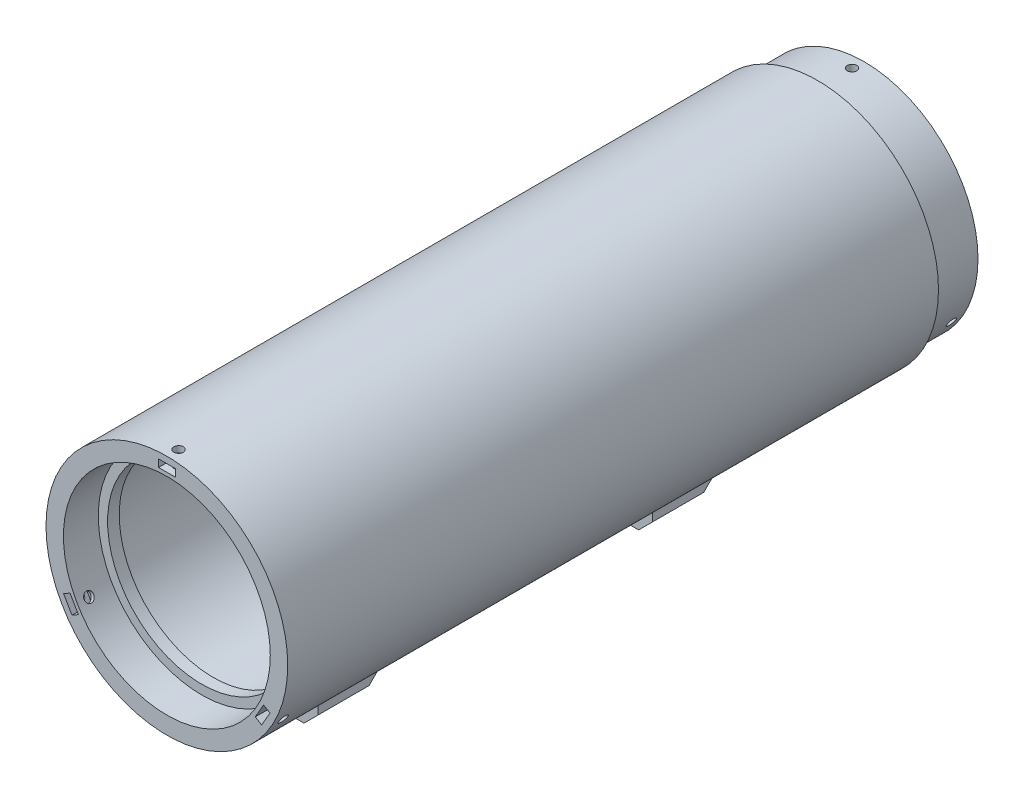
from build123d import *

# Parameters (mm, degrees)
SKETCH2_R                   = 31.115
SKETCH2_R_2                 = 23.495
BOSS_EXTRUDE1_DEPTH         = 12.7
BOSS_EXTRUDE2_START         = -6.35
SKETCH3_R                   = 23.495
SKETCH3_R_2                 = 19.685
BOSS_EXTRUDE2_DEPTH         = 6.35
M2_CLEARANCE_HOLE1_REACH    = 72.725
M2_CLEARANCE_HOLE1_BORE_R   = 1.3
CIRPATTERN1_COUNT           = 3
SKETCH7_W                   = 4.572
SKETCH7_H                   = 1.905
CUT_EXTRUDE1_DEPTH          = 5.461
CIRPATTERN2_COUNT           = 3
SKETCH8_R                   = 33.02
SKETCH8_R_2                 = 28.2575
BOSS_EXTRUDE3_DEPTH         = 177.8
M2_CLEARANCE_HOLE2_REACH    = 206.308
M2_CLEARANCE_HOLE2_BORE_R   = 1.3
SKETCH11_W                  = 4.572
SKETCH11_H                  = 2.032
CUT_EXTRUDE2_DEPTH          = 5.461
BOSS_EXTRUDE4_START         = -6.35
SKETCH12_R                  = 28.2575
SKETCH12_R_2                = 25.7175
BOSS_EXTRUDE4_DEPTH         = 6.35
CIRPATTERN3_COUNT           = 3
CUT_EXTRUDE5_START          = -3.175
SKETCH14_R                  = 28.2575
SKETCH14_R_2                = 25.7175
CUT_EXTRUDE5_DEPTH          = 3.175
SKETCH15_W                  = 19.05
SKETCH15_H                  = 22.86
BOSS_EXTRUDE5_DEPTH         = 12.7
F_1_4_CLEARANCE_HOLE1_D     = 7.14248
F_1_4_CLEARANCE_HOLE1_DEPTH = 12.7
SKETCH18_W                  = 11.43
SKETCH18_H                  = 5.842
CUT_EXTRUDE6_DEPTH          = 11.43
CHAMFER2_SIZE               = 3.81
CHAMFER3_SIZE               = 12.7
SKETCH19_W                  = 11.43
SKETCH19_H                  = 5.842
CUT_EXTRUDE7_DEPTH          = 11.43


with BuildPart() as part:
    # Sketch2 → Boss-Extrude1 (new body)
    with BuildSketch(Plane.XY):
        Circle(SKETCH2_R)
        Circle(SKETCH2_R_2, mode=Mode.SUBTRACT)
    extrude(amount=BOSS_EXTRUDE1_DEPTH)

    # Sketch3 → Boss-Extrude2 (add)
    with BuildSketch(Plane.XY.offset(12.7).offset(BOSS_EXTRUDE2_START)):
        Circle(SKETCH3_R)
        Circle(SKETCH3_R_2, mode=Mode.SUBTRACT)
    extrude(amount=BOSS_EXTRUDE2_DEPTH)

    # M2 Clearance Hole1 bore → M2 Clearance Hole1 (cut, up to next)
    with BuildSketch(Plane(origin=(0, 31.115, 0), x_dir=(1, 0, 0), z_dir=(0, 1, 0)), mode=Mode.PRIVATE) as m2_clearance_hole1_sk1:
        with Locations((-0.127, -3.175)):
            Circle(M2_CLEARANCE_HOLE1_BORE_R)
    m2_clearance_hole1_tool1 = extrude(m2_clearance_hole1_sk1.sketch, amount=-M2_CLEARANCE_HOLE1_REACH, mode=Mode.PRIVATE) & part.part
    m2_clearance_hole1 = m2_clearance_hole1_tool1.solids().sort_by_distance((-0.127, 31.115, 3.175))[0]
    add(m2_clearance_hole1, mode=Mode.SUBTRACT)

    # CirPattern1: M2 Clearance Hole1 ×3 about axis
    cirpattern1_axis = Axis((0, 0, 0), (0, 0, 1))
    for i in range(1, CIRPATTERN1_COUNT):
        add(m2_clearance_hole1.rotate(cirpattern1_axis, i * 360 / CIRPATTERN1_COUNT), mode=Mode.SUBTRACT)

    # Sketch7 → Cut-Extrude1 (cut)
    with BuildSketch(Plane(origin=(0, 0, 0), x_dir=(-1, 0, 0), z_dir=(0, 0, -1))):
        with Locations((0.097, 26.3525)):
            Rectangle(SKETCH7_W, SKETCH7_H)
    cut_extrude1 = extrude(amount=-CUT_EXTRUDE1_DEPTH, mode=Mode.SUBTRACT)

    # CirPattern2: Cut-Extrude1 ×3 about axis
    cirpattern2_axis = Axis((0, 0, 0), (0, 0, 1))
    for i in range(1, CIRPATTERN2_COUNT):
        add(cut_extrude1.rotate(cirpattern2_axis, i * 360 / CIRPATTERN2_COUNT), mode=Mode.SUBTRACT)

    # Sketch8 → Boss-Extrude3 (add)
    with BuildSketch(Plane.XY.offset(12.7)):
        Circle(SKETCH8_R)
        Circle(SKETCH8_R_2, mode=Mode.SUBTRACT)
    extrude(amount=BOSS_EXTRUDE3_DEPTH)

    # M2 Clearance Hole2 bore → M2 Clearance Hole2 (cut, up to next)
    with BuildSketch(Plane(origin=(0, 33.02, 0), x_dir=(1, 0, 0), z_dir=(0, 1, 0)), mode=Mode.PRIVATE) as m2_clearance_hole2_sk1:
        with Locations((0, -187.325)):
            Circle(M2_CLEARANCE_HOLE2_BORE_R)
    m2_clearance_hole2_tool1 = extrude(m2_clearance_hole2_sk1.sketch, amount=-M2_CLEARANCE_HOLE2_REACH, mode=Mode.PRIVATE) & part.part
    m2_clearance_hole2 = m2_clearance_hole2_tool1.solids().sort_by_distance((0, 33.02, 187.325))[0]
    add(m2_clearance_hole2, mode=Mode.SUBTRACT)

    # Sketch11 → Cut-Extrude2 (cut)
    with BuildSketch(Plane.XY.offset(190.5)):
        with Locations((0.03, 30.226)):
            Rectangle(SKETCH11_W, SKETCH11_H)
    cut_extrude2 = extrude(amount=-CUT_EXTRUDE2_DEPTH, mode=Mode.SUBTRACT)

    # Sketch12 → Boss-Extrude4 (add)
    with BuildSketch(Plane.XY.offset(184.15).offset(BOSS_EXTRUDE4_START)):
        Circle(SKETCH12_R)
        Circle(SKETCH12_R_2, mode=Mode.SUBTRACT)
    extrude(amount=BOSS_EXTRUDE4_DEPTH)

    # CirPattern3: M2 Clearance Hole2, Cut-Extrude2 ×3 about axis
    cirpattern3_axis = Axis((0, 0, 0), (0, 0, 1))
    add([m2_clearance_hole2.rotate(cirpattern3_axis, i * 360 / CIRPATTERN3_COUNT) for i in range(1, CIRPATTERN3_COUNT)], mode=Mode.SUBTRACT)
    add([cut_extrude2.rotate(cirpattern3_axis, i * 360 / CIRPATTERN3_COUNT) for i in range(1, CIRPATTERN3_COUNT)], mode=Mode.SUBTRACT)

    # Sketch14 → Cut-Extrude5 (cut)
    with BuildSketch(Plane.XY.offset(184.15).offset(CUT_EXTRUDE5_START)):
        Circle(SKETCH14_R)
        Circle(SKETCH14_R_2, mode=Mode.SUBTRACT)
    extrude(amount=CUT_EXTRUDE5_DEPTH, mode=Mode.SUBTRACT)

    # Sketch15 → Boss-Extrude5 (add)
    with BuildSketch(Plane(origin=(0, -30.48, 0), x_dir=(1, 0, 0), z_dir=(0, 1, 0))):
        with Locations((0, -147.32)):
            Rectangle(SKETCH15_W, SKETCH15_H)
        with Locations((0, -55.88)):
            Rectangle(SKETCH15_W, SKETCH15_H)
    extrude(amount=-BOSS_EXTRUDE5_DEPTH)

    # 1/4 Clearance Hole1
    with Locations(Plane(origin=(0, -43.18, 0), x_dir=(-1, 0, 0), z_dir=(0, -1, 0))):
        with Locations((0, -153.67), (0, -62.23)):
            Hole(F_1_4_CLEARANCE_HOLE1_D / 2, depth=F_1_4_CLEARANCE_HOLE1_DEPTH)

    # Sketch18 → Cut-Extrude6 (cut)
    with BuildSketch(Plane.XY.offset(158.75)):
        with Locations((0, -37.338)):
            Rectangle(SKETCH18_W, SKETCH18_H)
    extrude(amount=-CUT_EXTRUDE6_DEPTH, mode=Mode.SUBTRACT)

    # Chamfer2
    chamfer2_edges = [part.edges().sort_by_distance(p)[0] for p in [
        (-9.525, -43.18, 147.32),
        (9.525, -43.18, 147.32),
        (-9.525, -43.18, 55.88),
        (9.525, -43.18, 55.88),
    ]]
    chamfer(chamfer2_edges, length=CHAMFER2_SIZE)

    # Chamfer3
    # the kernel refuses this chamfer: 12.7 mm, written as the material it takes off along each edge
    with BuildSketch(Plane(origin=(38.375373947, -43.18, 135.89), x_dir=(0, 0.9996219169112966, -0.02749587661058565), z_dir=(-1, 0, 0))) as chamfer3_piece_1_section:
        Polygon((CHAMFER3_SIZE * 0.999621916911, -CHAMFER3_SIZE * 0.0274958766106), (-CHAMFER3_SIZE * 0.0274958766106, -CHAMFER3_SIZE * 0.999621916911), (0, 0), align=None)
    chamfer3_piece_1 = extrude(amount=76.750747894, mode=Mode.PRIVATE)
    chamfer3_piece_1 = chamfer3_piece_1 - Plane(origin=(0, 0, 140.118292277), x_dir=(1, 0, 0), z_dir=(0, 0, -1)) * Cylinder(33.02, 205, mode=Mode.PRIVATE)
    add(chamfer3_piece_1, mode=Mode.SUBTRACT)
    with BuildSketch(Plane(origin=(38.375373947, -43.18, 44.45), x_dir=(0, 0.9996219169112966, -0.027495876610586195), z_dir=(-1, 0, 0))) as chamfer3_piece_2_section:
        Polygon((CHAMFER3_SIZE * 0.999621916911, -CHAMFER3_SIZE * 0.0274958766106), (-CHAMFER3_SIZE * 0.0274958766106, -CHAMFER3_SIZE * 0.999621916911), (0, 0), align=None)
    chamfer3_piece_2 = extrude(amount=76.750747894, mode=Mode.PRIVATE)
    chamfer3_piece_2 = chamfer3_piece_2 - Plane(origin=(0, 0, 48.678292277), x_dir=(1, 0, 0), z_dir=(0, 0, -1)) * Cylinder(33.02, 205, mode=Mode.PRIVATE)
    add(chamfer3_piece_2, mode=Mode.SUBTRACT)

    # Sketch19 → Cut-Extrude7 (cut)
    with BuildSketch(Plane.XY.offset(67.31)):
        with Locations((0, -37.338)):
            Rectangle(SKETCH19_W, SKETCH19_H)
    extrude(amount=-CUT_EXTRUDE7_DEPTH, mode=Mode.SUBTRACT)


solid = part.part
